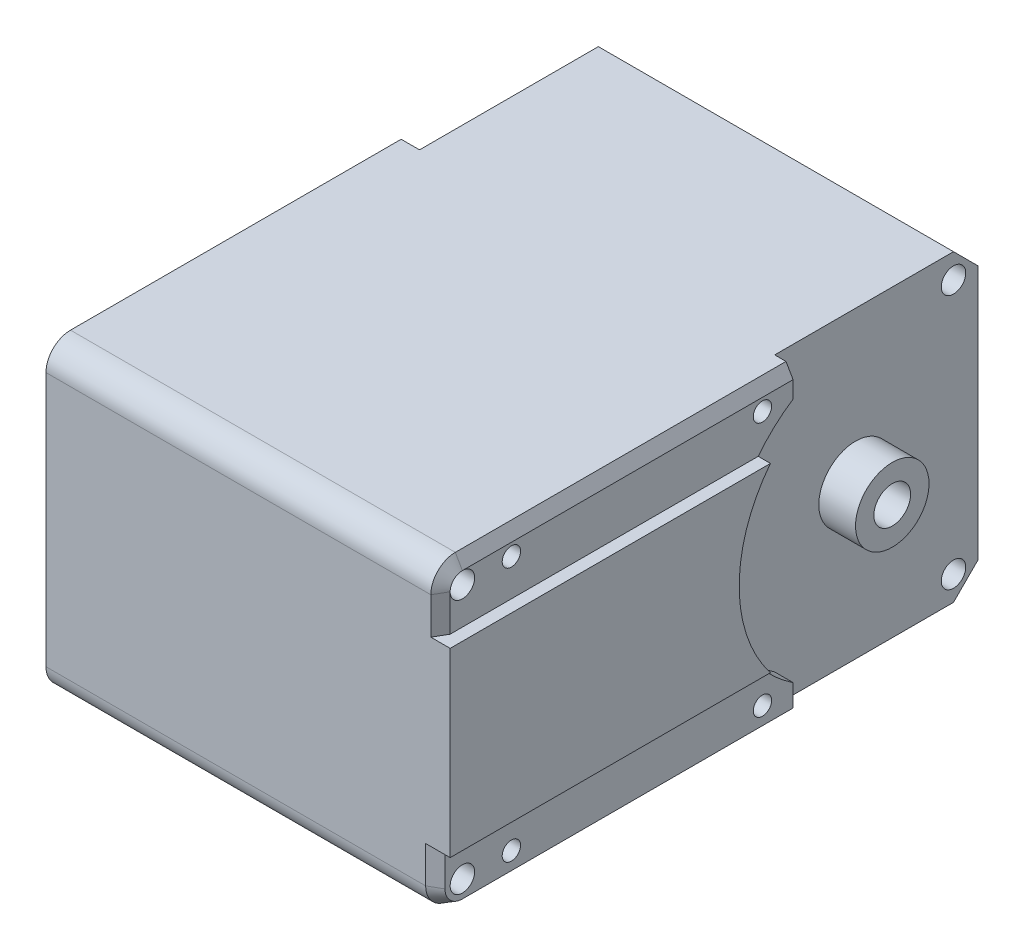
from build123d import *
from OCP.BRepFilletAPI import BRepFilletAPI_MakeChamfer

# Parameters (mm, degrees)
SKETCH3_W           = 45.6
SKETCH3_H           = 24.8
BOSS_EXTRUDE1_DEPTH = 29
SKETCH4_W           = 29
SKETCH4_H           = 24.8
BOSS_EXTRUDE2_DEPTH = 1.5
SKETCH6_R           = 12
CUT_EXTRUDE1_DEPTH  = 1.5
BOSS_EXTRUDE3_DEPTH = 1
SKETCH10_W          = 12
SKETCH10_H          = 18.8
BOSS_EXTRUDE5_DEPTH = 1.5
CUT_EXTRUDE2_DEPTH  = 18.8
CUT_EXTRUDE3_DEPTH  = 1.5
SKETCH13_W          = 6
SKETCH13_H          = 20
CUT_EXTRUDE4_DEPTH  = 5
SKETCH14_R          = 0.75
CUT_EXTRUDE5_DEPTH  = 5
SKETCH8_R           = 1
CUT_EXTRUDE6_DEPTH  = 5
CUT_EXTRUDE7_START  = -5
SKETCH15_R          = 0.75
CUT_EXTRUDE7_DEPTH  = 5
SKETCH17_R          = 0.75
CUT_EXTRUDE8_DEPTH  = 5
SKETCH18_R          = 3
BOSS_EXTRUDE6_DEPTH = 3
SKETCH19_R          = 1.5
CUT_EXTRUDE9_DEPTH  = 3
FILLET1_R           = 2
CHAMFER1_SIZE       = 2
CHAMFER2_SIZE       = 1
CHAMFER2_SIZE_2     = 0.577350269
BOSS_EXTRUDE7_START = 3
SKETCH9_R           = 3
SKETCH9_R_2         = 1.25
BOSS_EXTRUDE7_DEPTH = 3


with BuildPart() as part:
    # Sketch3 → Boss-Extrude1 (new body)
    with BuildSketch(Plane(origin=(0, 0, 0), x_dir=(0, 0, -1), z_dir=(1, 0, 0))):
        Rectangle(SKETCH3_W, SKETCH3_H)
    extrude(amount=BOSS_EXTRUDE1_DEPTH)

    # Sketch4 → Boss-Extrude2 (add)
    with BuildSketch(Plane(origin=(29, 0, 0), x_dir=(0, 0, -1), z_dir=(1, 0, 0))):
        with Locations((-8.3, 0)):
            Rectangle(SKETCH4_W, SKETCH4_H)
    boss_extrude2 = extrude(amount=BOSS_EXTRUDE2_DEPTH)

    # Sketch6 → Cut-Extrude1 (cut)
    with BuildSketch(Plane(origin=(29, 0, 0), x_dir=(0, 0, -1), z_dir=(1, 0, 0))):
        with Locations((12.8, 0)):
            Circle(SKETCH6_R)
    cut_extrude1 = extrude(amount=CUT_EXTRUDE1_DEPTH, mode=Mode.SUBTRACT)

    # Sketch7 → Boss-Extrude3 (add)
    with BuildSketch(Plane(origin=(30.5, 0, 0), x_dir=(0, 0, -1), z_dir=(1, 0, 0))):
        with BuildLine():
            Line((-22.8, 7.4), (3.353307457, 7.4))
            ThreePointArc((3.353307457, 7.4), (0.8, 0), (3.353307457, -7.4))
            Line((3.353307457, -7.4), (-22.8, -7.4))
            Line((-22.8, -7.4), (-22.8, 7.4))
        make_face()
    extrude(amount=BOSS_EXTRUDE3_DEPTH)

    # Mirror2: Boss-Extrude2, Cut-Extrude1 across plane
    add(boss_extrude2.mirror(Plane.ZY.offset(-14.5)))
    add(cut_extrude1.mirror(Plane.ZY.offset(-14.5)), mode=Mode.SUBTRACT)

    # Sketch10 → Boss-Extrude5 (add)
    with BuildSketch(Plane.ZY.offset(1.5)):
        with Locations((11.3, 0)):
            Rectangle(SKETCH10_W, SKETCH10_H)
    extrude(amount=BOSS_EXTRUDE5_DEPTH)

    # Sketch11 → Cut-Extrude2 (cut)
    with BuildSketch(Plane.XZ.offset(9.4)):
        Polygon((-3, 7.3), (-1.5, 5.3), (-3, 5.3), align=None)
    extrude(amount=-CUT_EXTRUDE2_DEPTH, mode=Mode.SUBTRACT)

    # Sketch12 → Cut-Extrude3 (cut)
    with BuildSketch(Plane.ZY.offset(1.5)):
        with BuildLine():
            Line((5.3, -10.4), (-0.7, -10.4))
            Line((-0.7, -10.4), (-0.7, -6.479969136))
            Line((-0.7, -6.479969136), (-2.7, -6.479969136))
            ThreePointArc((-2.7, -6.479969136), (-0.8, 0), (-2.7, 6.479969136))
            Line((-2.7, 6.479969136), (-0.7, 6.479969136))
            Line((-0.7, 6.479969136), (-0.7, 9.6))
            Line((-0.7, 9.6), (5.3, 9.6))
            Line((5.3, 9.6), (5.3, -10.4))
        make_face()
    extrude(amount=-CUT_EXTRUDE3_DEPTH, mode=Mode.SUBTRACT)

    # Sketch13 → Cut-Extrude4 (cut)
    with BuildSketch(Plane.ZY):
        with Locations((2.3, -0.4)):
            Rectangle(SKETCH13_W, SKETCH13_H)
    extrude(amount=-CUT_EXTRUDE4_DEPTH, mode=Mode.SUBTRACT)

    # Sketch14 → Cut-Extrude5 (cut)
    with BuildSketch(Plane.ZY.offset(1.5)):
        with Locations((20.8, 10.4)):
            Circle(SKETCH14_R)
        with Locations((20.8, -10.4)):
            Circle(SKETCH14_R)
        with Locations((-3.7, 10.4)):
            Circle(SKETCH14_R)
        with Locations((-3.7, -10.4)):
            Circle(SKETCH14_R)
    extrude(amount=-CUT_EXTRUDE5_DEPTH, mode=Mode.SUBTRACT)

    # Sketch8 → Cut-Extrude6 (cut)
    with BuildSketch(Plane(origin=(30.5, 0, 0), x_dir=(0, 0, -1), z_dir=(1, 0, 0))):
        with Locations((-20.8, 10.4)):
            Circle(SKETCH8_R)
        with Locations((-20.8, -10.4)):
            Circle(SKETCH8_R)
    cut_extrude6 = extrude(amount=-CUT_EXTRUDE6_DEPTH, mode=Mode.SUBTRACT)

    # Sketch15 → Cut-Extrude7 (cut)
    with BuildSketch(Plane(origin=(30.5, 0, 0), x_dir=(0, 0, -1), z_dir=(1, 0, 0)).offset(CUT_EXTRUDE7_START)):
        with Locations(Location((3.7, -10.4, 0), (0, 0, 180))):
            Circle(SKETCH15_R)
        with Locations(Location((3.7, 10.4, 0), (0, 0, 180))):
            Circle(SKETCH15_R)
    extrude(amount=CUT_EXTRUDE7_DEPTH, mode=Mode.SUBTRACT)

    # Sketch17 → Cut-Extrude8 (cut)
    with BuildSketch(Plane(origin=(30.5, 0, 0), x_dir=(0, 0, -1), z_dir=(1, 0, 0))):
        with Locations((-16.8, 10.4)):
            Circle(SKETCH17_R)
        with Locations((-16.8, -10.4)):
            Circle(SKETCH17_R)
    extrude(amount=-CUT_EXTRUDE8_DEPTH, mode=Mode.SUBTRACT)

    # Mirror3: Cut-Extrude6 across plane
    add(cut_extrude6.mirror(Plane.XY), mode=Mode.SUBTRACT)

    # Sketch18 → Boss-Extrude6 (add)
    with BuildSketch(Plane(origin=(29, 0, 0), x_dir=(0, 0, -1), z_dir=(1, 0, 0))):
        with Locations(Location((12.8, 0, 0), (0, 0, 180))):
            Circle(SKETCH18_R)
    extrude(amount=BOSS_EXTRUDE6_DEPTH)

    # Sketch19 → Cut-Extrude9 (cut)
    with BuildSketch(Plane(origin=(32, 0, 0), x_dir=(0, 0, -1), z_dir=(1, 0, 0))):
        with Locations((12.8, 0)):
            Circle(SKETCH19_R)
    extrude(amount=-CUT_EXTRUDE9_DEPTH, mode=Mode.SUBTRACT)

    # Fillet1
    fillet1_edges = [part.edges().sort_by_distance(p)[0] for p in [
        (14.5, -12.4, 22.8),
        (14.5, 12.4, 22.8),
    ]]
    fillet(fillet1_edges, radius=FILLET1_R)

    # Chamfer1
    chamfer1_edges = [part.edges().sort_by_distance(p)[0] for p in [
        (14.5, -12.4, -22.8),
        (14.5, 12.4, -22.8),
    ]]
    chamfer(chamfer1_edges, length=CHAMFER1_SIZE)

    # Chamfer2
    chamfer2_edges_1 = [part.edges().sort_by_distance(p)[0] for p in [
        (30.5, -12.4, 7.3),
    ]]
    chamfer2_side_1 = [part.faces().sort_by_distance(p)[0] for p in [
        (30.488452995, -12.4, 7.3),
    ]]
    chamfer2_edges_2 = [part.edges().sort_by_distance(p)[0] for p in [
        (30.5, 8.9, 22.8),
    ]]
    chamfer2_side_2 = [part.faces().sort_by_distance(p)[0] for p in [
        (30.488452995, 8.9, 22.8),
    ]]
    chamfer2_edges_3 = [part.edges().sort_by_distance(p)[0] for p in [
        (30.5, 12.4, 7.3),
    ]]
    chamfer2_side_3 = [part.faces().sort_by_distance(p)[0] for p in [
        (30.488452995, 12.4, 7.3),
    ]]
    chamfer2_edges_4 = [part.edges().sort_by_distance(p)[0] for p in [
        (30.5, 11.814213562, 22.214213562),
    ]]
    chamfer2_side_4 = [part.faces().sort_by_distance(p)[0] for p in [
        (30.488452995, 11.814213562, 22.214213562),
    ]]
    chamfer2_edges_5 = [part.edges().sort_by_distance(p)[0] for p in [
        (30.5, -11.814213562, 22.214213562),
    ]]
    chamfer2_side_5 = [part.faces().sort_by_distance(p)[0] for p in [
        (30.5, -11.806048597, 22.206048597),
    ]]
    chamfer2_edges_6 = [part.edges().sort_by_distance(p)[0] for p in [
        (30.5, -8.9, 22.8),
    ]]
    chamfer2_side_6 = [part.faces().sort_by_distance(p)[0] for p in [
        (30.5, -8.9, 22.788452995),
    ]]
    chamfer2 = BRepFilletAPI_MakeChamfer(part.part.solid().wrapped)
    for e in chamfer2_edges_1:
        chamfer2.Add(CHAMFER2_SIZE - 0.0001, CHAMFER2_SIZE_2 - 0.0001, e.wrapped, chamfer2_side_1[0].wrapped)
    for e in chamfer2_edges_2:
        chamfer2.Add(CHAMFER2_SIZE_2 - 0.0001, CHAMFER2_SIZE - 0.0001, e.wrapped, chamfer2_side_2[0].wrapped)
    for e in chamfer2_edges_3:
        chamfer2.Add(CHAMFER2_SIZE_2 - 0.0001, CHAMFER2_SIZE - 0.0001, e.wrapped, chamfer2_side_3[0].wrapped)
    for e in chamfer2_edges_4:
        chamfer2.Add(CHAMFER2_SIZE_2 - 0.0001, CHAMFER2_SIZE - 0.0001, e.wrapped, chamfer2_side_4[0].wrapped)
    for e in chamfer2_edges_5:
        chamfer2.Add(CHAMFER2_SIZE_2 - 0.0001, CHAMFER2_SIZE - 0.0001, e.wrapped, chamfer2_side_5[0].wrapped)
    for e in chamfer2_edges_6:
        chamfer2.Add(CHAMFER2_SIZE_2 - 0.0001, CHAMFER2_SIZE - 0.0001, e.wrapped, chamfer2_side_6[0].wrapped)
    add(Compound.cast(chamfer2.Shape()), mode=Mode.REPLACE)  # a hair under: the kernel refuses the full size

    # Sketch9 → Boss-Extrude7 (add)
    with BuildSketch(Plane.ZY.offset(BOSS_EXTRUDE7_START)):
        with Locations((-12.8, 0)):
            Circle(SKETCH9_R)
        with Locations((-12.8, 0)):
            Circle(SKETCH9_R_2, mode=Mode.SUBTRACT)
    extrude(amount=-BOSS_EXTRUDE7_DEPTH)


solid = part.part
